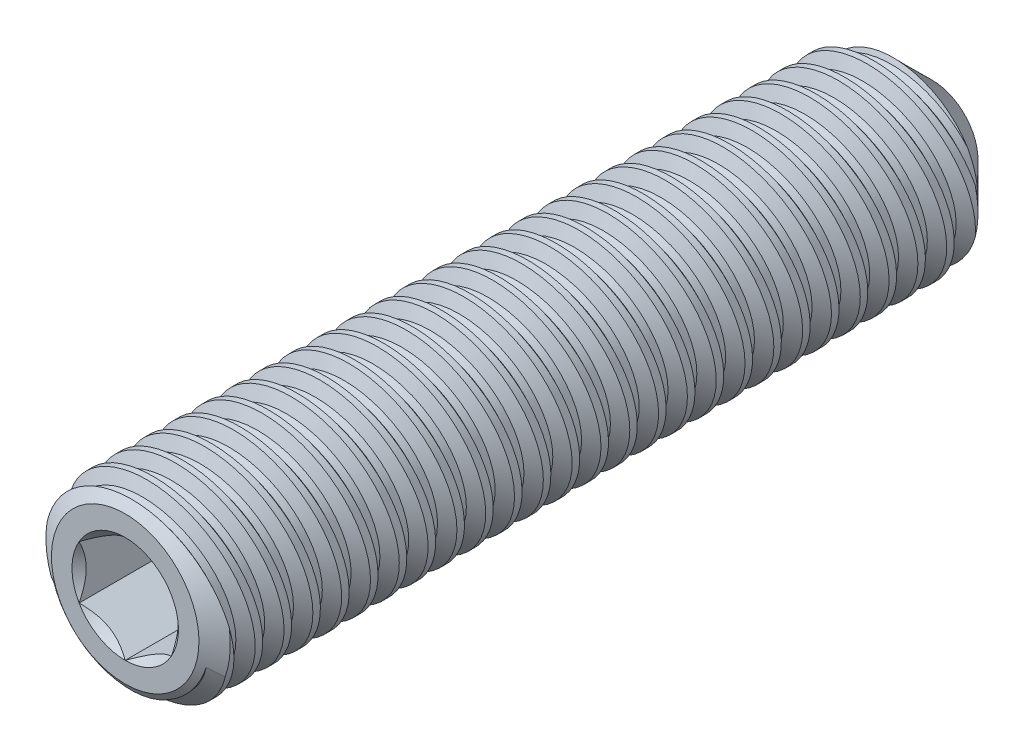
from build123d import *

# Parameters (mm, degrees)
LPATTERN1_COUNT      = 27
LPATTERN1_PITCH      = 1.25
LPATTERN1_COUNT_DIR2 = 2
LPATTERN1_PITCH_DIR2 = 1.25
CUT_EXTRUDE10_DEPTH  = 4


with BuildPart() as part:
    # Sketch22 → Revolve1 (revolve)
    with BuildSketch(Plane(origin=(0, 0, 0), x_dir=(0, 0, -1), z_dir=(1, 0, 0))):
        Polygon((-16.899139381, 0), (-16.899139381, 3.2), (-16.33897335, 4), (16.100860619, 4), (18.100860619, 2), (16.899139381, 0), align=None)
    revolve(axis=Axis((0, 0, -16.899139381), (0, 0, -1)))

    # Sketch6 → Cut-Revolve8 (revolve, cut)
    with BuildSketch(Plane(origin=(0, 0, 0), x_dir=(0, 0, -1), z_dir=(1, 0, 0))):
        Polygon((15.092725821, 3.464196131), (14.78397206, 3.415953356), (14.293581187, 4.024121388), (15.374219349, 4.1929711), align=None)
    cut_revolve8 = revolve(axis=Axis((0, 0.208852549, -16.812516931), (0, -0.15437688027361343, 0.9880120337511009)), mode=Mode.SUBTRACT)

    # LPattern1: Cut-Revolve8 27 × 2
    with Locations(*[Vector(0, 0, 1) * (i * LPATTERN1_PITCH) + Vector(0, 0, -1) * (j * LPATTERN1_PITCH_DIR2) for i in range(LPATTERN1_COUNT) for j in range(LPATTERN1_COUNT_DIR2) if (i, j) != (0, 0)]):
        add(cut_revolve8, mode=Mode.SUBTRACT)

    # Sketch23 → Cut-Extrude10 (cut)
    with BuildSketch(Plane.XY.offset(16.899139381)):
        Polygon((0, 2.309401077), (-2, 1.154700538), (-2, -1.154700538), (0, -2.309401077), (2, -1.154700538), (2, 1.154700538), align=None)
    extrude(amount=-CUT_EXTRUDE10_DEPTH, mode=Mode.SUBTRACT)

    # Cut-Extrude11 cone 1 section (through the dimple's axis) → Cut-Extrude11 (revolve, cut)
    with BuildSketch(Plane(origin=(0, 0, 16.899139381), x_dir=(0, -1, 0), z_dir=(1, 0, 0))):
        Polygon((0, 0), (2.309401077, 0), (0, 2.309401077), align=None)
    revolve(axis=Axis((0, 0, 16.899139381), (0, 0, -1)), mode=Mode.SUBTRACT)

    # Cut-Extrude12 cone 1 section (through the dimple's axis) → Cut-Extrude12 (revolve, cut)
    with BuildSketch(Plane(origin=(0, 0, 12.899139381), x_dir=(0, -1, 0), z_dir=(1, 0, 0))):
        Polygon((0, 0), (2, 0), (0, 1.201721238), align=None)
    revolve(axis=Axis((0, 0, 12.899139381), (0, 0, -1)), mode=Mode.SUBTRACT)


solid = part.part
